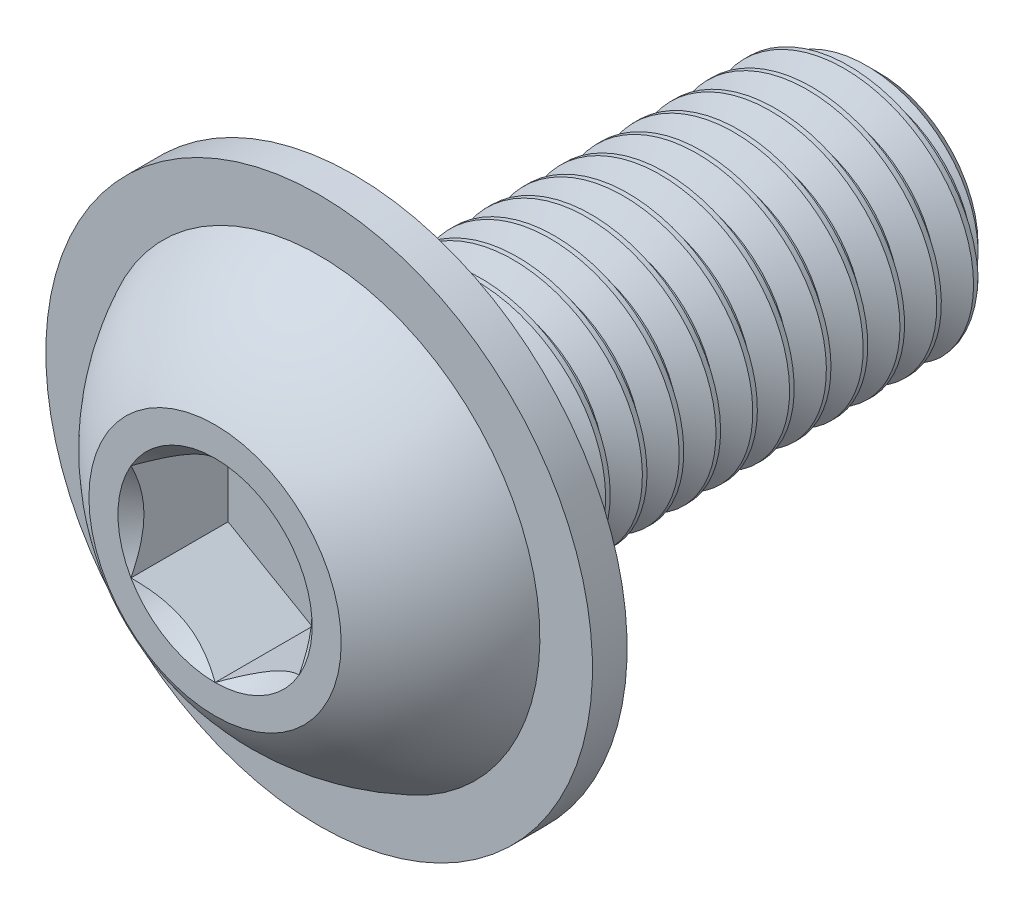
from build123d import *

# Parameters (mm, degrees)
SKETCH13_W         = 25
SKETCH13_H         = 6
CHAMFER1_SIZE      = 1.3125
CUT_EXTRUDE2_DEPTH = 4.62
CUT_SWEEP1_PITCH   = 1.75
CUT_SWEEP1_TO      = 25


with BuildPart() as part:
    # Sketch13 → Revolve1 (revolve)
    with BuildSketch(Plane(origin=(0, 0, 0), x_dir=(0, 0, -1), z_dir=(1, 0, 0)), mode=Mode.PRIVATE) as revolve1_sk:
        with Locations((3.3, 3)):
            Rectangle(SKETCH13_W, SKETCH13_H)
    revolve(revolve1_sk.sketch.rotate(Axis((0, 0, 15.8), (0, 0, -1)), 90), axis=Axis((0, 0, 15.8), (0, 0, -1)))

    # Chamfer1
    chamfer1_edges = [part.edges().sort_by_distance(p)[0] for p in [
        (-6, 0, -15.8),
    ]]
    chamfer(chamfer1_edges, length=CHAMFER1_SIZE)

    # Sketch7 → Revolve2 (revolve)
    with BuildSketch(Plane(origin=(0, 0, 0), x_dir=(0, 0, -1), z_dir=(1, 0, 0)), mode=Mode.PRIVATE) as revolve2_sk:
        with BuildLine():
            Line((-9.2, 10.5), (-9.2, 0))
            Line((-9.2, 0), (-15.8, 0))
            Line((-15.8, 0), (-15.8, 6))
            ThreePointArc((-15.8, 6), (-13.65523, 8.613253), (-10.85, 10.5))
            Line((-10.85, 10.5), (-10.85, 13))
            Line((-10.85, 13), (-9.2, 13))
            Line((-9.2, 13), (-9.2, 10.5))
        make_face()
    revolve(revolve2_sk.sketch.rotate(Axis((0, 0, 15.8), (0, 0, -1)), 180), axis=Axis((0, 0, 15.8), (0, 0, -1)))

    # Sketch5 → Cut-Extrude2 (cut)
    with BuildSketch(Plane.XY.offset(15.8)):
        Polygon((4, -2.309401), (4, 2.309401), (0, 4.618802), (-4, 2.309401), (-4, -2.309401), (0, -4.618802), align=None)
    extrude(amount=-CUT_EXTRUDE2_DEPTH, mode=Mode.SUBTRACT)

    # Cut-Extrude3 cone 1 section (through the dimple's axis) → Cut-Extrude3 (revolve, cut)
    with BuildSketch(Plane(origin=(0, 0, 15.8), x_dir=(0, -1, 0), z_dir=(1, 0, 0))):
        Polygon((0, 0), (4.618802, 0), (0, 4.618802), align=None)
    revolve(axis=Axis((0, 0, 15.8), (0, 0, -1)), mode=Mode.SUBTRACT)


with BuildPart() as body_2:
    # Split1: read off the stored shape, not the designer's step
    # Split1: the piece on the far side of the plane
    add(part.part)
    split(bisect_by=Plane.XY.offset(9.2), keep=Keep.BOTTOM)

    # Cut-Sweep1: arcs per turn and ends read off the stored shape
    # Cut-Sweep1: the profile of Sketch16 screwed along a right-hand helix through 15.285714 turns, 10 arcs to a turn; built about Z, then put on its axis
    cut_sweep1_z = Axis((0, 0, 0), (0, 0, 1))
    cut_sweep1_corners = [(4.863342, 0, -0.65625), (6.094722, 0, 0.054688), (6.094722, 0, -1.585938), (4.863342, 0, -0.875)]
    with BuildLine(mode=Mode.PRIVATE) as cut_sweep1_profile:
        Line(cut_sweep1_corners[0], cut_sweep1_corners[1])
        Line(cut_sweep1_corners[1], cut_sweep1_corners[2])
        Line(cut_sweep1_corners[2], cut_sweep1_corners[3])
        Line(cut_sweep1_corners[3], cut_sweep1_corners[0])
    cut_sweep1_cap = Face(cut_sweep1_profile.wire())
    cut_sweep1_turn_angles = [0, 18, 36, 54, 72, 90, 108, 126, 144, 162, 180, 198, 216, 234, 252, 270, 288, 306, 324, 342, 360]
    cut_sweep1_turn_weights = [1, 0.9510565162951535, 1, 0.9510565162951535, 1, 0.9510565162951535, 1, 0.9510565162951535, 1, 0.9510565162951535, 1, 0.9510565162951535, 1, 0.9510565162951535, 1, 0.9510565162951535, 1, 0.9510565162951535, 1, 0.9510565162951535, 1]
    cut_sweep1_turn_rails = [Edge.make_bspline([Vector(p[0], p[1], 0).rotate(cut_sweep1_z, cut_sweep1_turn_angles[k]) / cut_sweep1_turn_weights[k] + Vector(0, 0, p[2] + CUT_SWEEP1_PITCH * cut_sweep1_turn_angles[k] / 360) for k in range(21)], [0, 0, 0, 1, 1, 2, 2, 3, 3, 4, 4, 5, 5, 6, 6, 7, 7, 8, 8, 9, 9, 10, 10, 10], 2, cut_sweep1_turn_weights) for p in cut_sweep1_corners]
    cut_sweep1_turn_sides = [Face.make_surface_from_curves(cut_sweep1_turn_rails[p[0]], cut_sweep1_turn_rails[p[1]]) for p in [(0, 1), (1, 2), (2, 3), (3, 0)]]
    cut_sweep1_last_angles = [5400, 5418, 5436, 5454, 5472, 5487.428571, 5502.857143]
    cut_sweep1_last_weights = [1, 0.9510565162951535, 1, 0.9510565162951535, 1, 0.9639628606958822, 1]
    cut_sweep1_last_rails = [Edge.make_bspline([Vector(p[0], p[1], 0).rotate(cut_sweep1_z, cut_sweep1_last_angles[k]) / cut_sweep1_last_weights[k] + Vector(0, 0, p[2] + CUT_SWEEP1_PITCH * cut_sweep1_last_angles[k] / 360) for k in range(7)], [0, 0, 0, 1, 1, 2, 2, 3, 3, 3], 2, cut_sweep1_last_weights) for p in cut_sweep1_corners]
    cut_sweep1_last_sides = [Face.make_surface_from_curves(cut_sweep1_last_rails[p[0]], cut_sweep1_last_rails[p[1]]) for p in [(0, 1), (1, 2), (2, 3), (3, 0)]]
    cut_sweep1 = Plane(origin=(0, 0, -15.8), x_dir=(0, 1, 0), z_dir=(0, 0, 1)) * split(Solid(Shell([*[p.moved(Location((0, 0, CUT_SWEEP1_PITCH * i))) for i in range(15) for p in cut_sweep1_turn_sides], *cut_sweep1_last_sides, cut_sweep1_cap, cut_sweep1_cap.rotate(cut_sweep1_z, 5502.857143).moved(Location((0, 0, CUT_SWEEP1_PITCH * 5502.857143 / 360)))])), bisect_by=Plane.XY.offset(CUT_SWEEP1_TO), keep=Keep.BOTTOM, mode=Mode.PRIVATE)
    add(cut_sweep1, mode=Mode.SUBTRACT)


with BuildPart() as part_1:
    add(part.part)

    # Split1
    split(bisect_by=Plane.XY.offset(9.2), keep=Keep.TOP)

    add(body_2.part)  # Boss-Extrude1 merges body 2
    # Boss-Extrude1: read off the stored shape, not the designer's step
    # Boss-Extrude1 outline → Boss-Extrude1 (revolve)
    with BuildSketch(Plane.XZ):
        Polygon((4.863341, 9.2), (4.863341, 6.077056), (6, 9.2), align=None)
    revolve(axis=Axis((0, 0, 0), (0, 0, 1)))


solid = part_1.part
